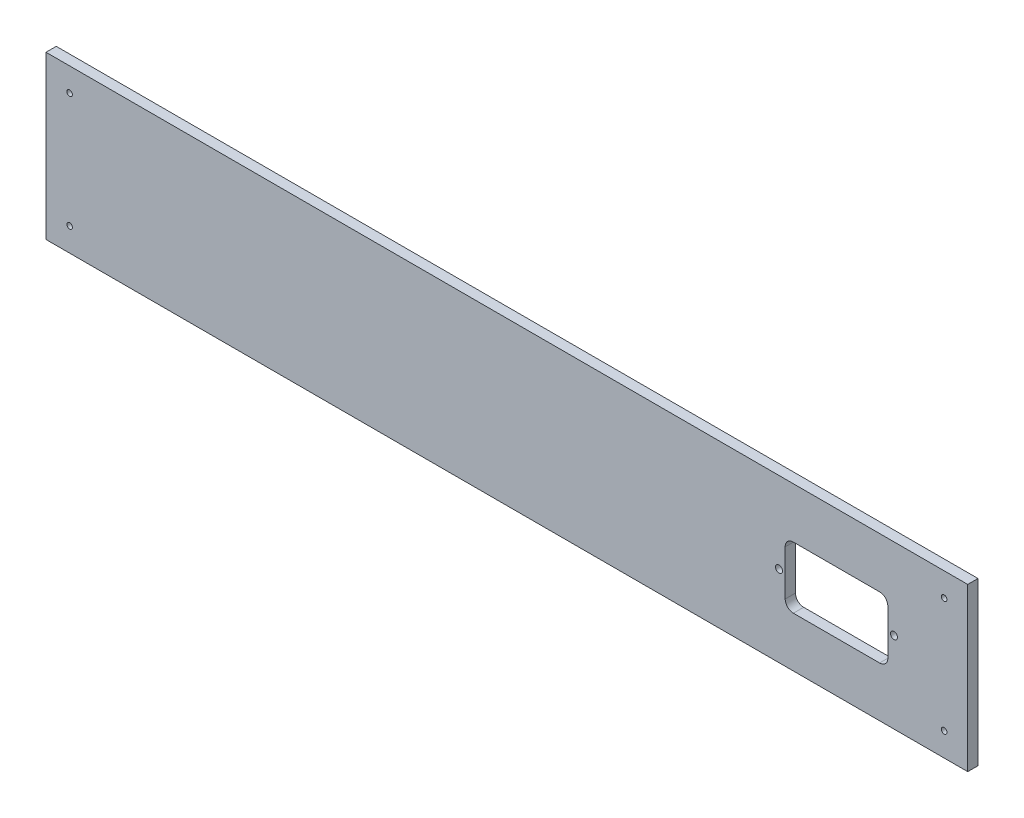
from build123d import *

# Parameters (mm, degrees)
SKETCH_F_W                   = 449
SKETCH_F_H                   = 79
SKETCH_F_R                   = 1.361667817
ESTRUSIONE_ESTRUSIONE1_DEPTH = 5
SKETCH1_R                    = 1.7
EXTRUDE1_DEPTH               = 456.924335828


with BuildPart() as part:
    # Sketch f → Estrusione-Estrusione1 (new body)
    with BuildSketch(Plane.XY):
        with Locations((224.5, 39.5)):
            Rectangle(SKETCH_F_W, SKETCH_F_H)
        with Locations((11.5, 67.5)):
            Circle(SKETCH_F_R, mode=Mode.SUBTRACT)
        with Locations((437.5, 67.5)):
            Circle(SKETCH_F_R, mode=Mode.SUBTRACT)
        with Locations((11.5, 11.5)):
            Circle(SKETCH_F_R, mode=Mode.SUBTRACT)
        with Locations((437.5, 11.5)):
            Circle(SKETCH_F_R, mode=Mode.SUBTRACT)
    extrude(amount=ESTRUSIONE_ESTRUSIONE1_DEPTH)

    # Sketch1 → Extrude1 (cut, through all)
    with BuildSketch(Plane(origin=(0, 0, 0), x_dir=(-1, 0, 0), z_dir=(0, 0, -1))):
        with Locations((-413.061242298, 39.505506417)):
            Circle(SKETCH1_R)
        with Locations((-357.061242298, 39.505506417)):
            Circle(SKETCH1_R)
        with BuildLine():
            Line((-364.0746338, 54.394920259), (-406.0746338, 54.394920259))
            ThreePointArc((-406.0746338, 54.394920259), (-408.903060925, 53.223347384), (-410.0746338, 50.394920259))
            Line((-410.0746338, 50.394920259), (-410.0746338, 28.394920259))
            ThreePointArc((-410.0746338, 28.394920259), (-408.903060925, 25.566493134), (-406.0746338, 24.394920259))
            Line((-406.0746338, 24.394920259), (-364.0746338, 24.394920259))
            ThreePointArc((-364.0746338, 24.394920259), (-361.246206675, 25.566493134), (-360.0746338, 28.394920259))
            Line((-360.0746338, 28.394920259), (-360.0746338, 50.394920259))
            ThreePointArc((-360.0746338, 50.394920259), (-361.246206675, 53.223347384), (-364.0746338, 54.394920259))
        make_face()
    extrude(amount=-EXTRUDE1_DEPTH, mode=Mode.SUBTRACT)


solid = part.part
